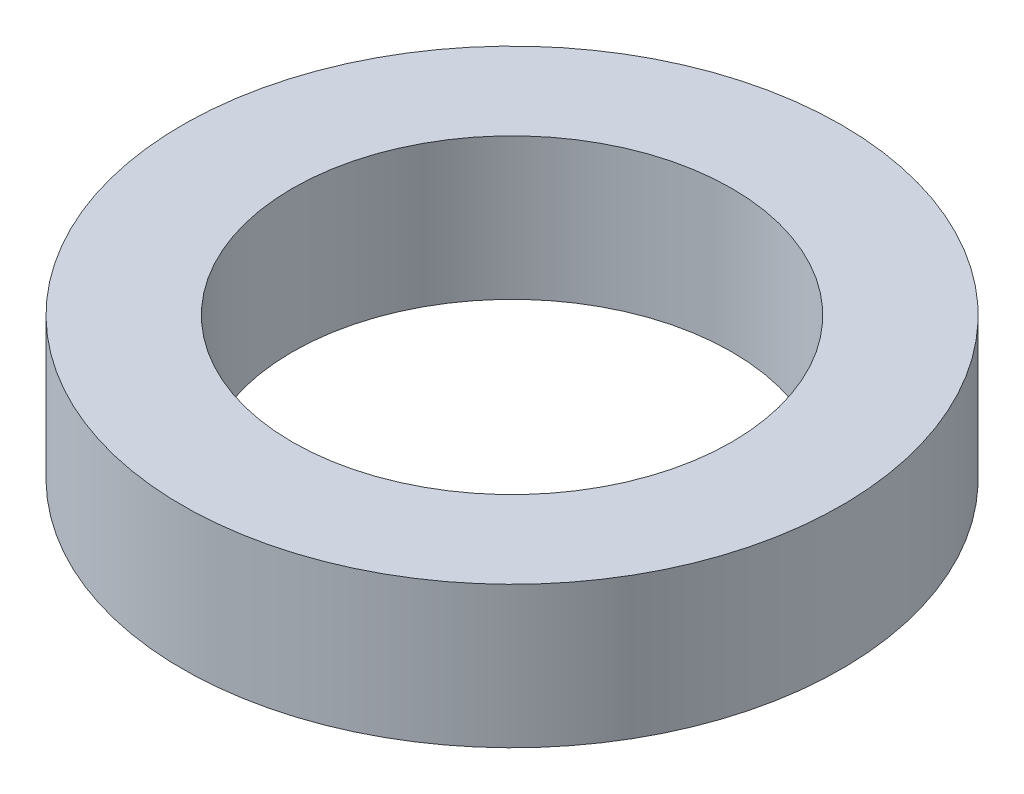
from build123d import *

# Parameters (mm, degrees)
SKETCH1_R           = 67.5
BOSS_EXTRUDE1_DEPTH = 29
SKETCH2_R           = 45
CUT_EXTRUDE1_DEPTH  = 100.767229089


with BuildPart() as part:
    # Sketch1 → Boss-Extrude1 (new body)
    with BuildSketch(Plane(origin=(0, 0, 0), x_dir=(1, 0, 0), z_dir=(0, 1, 0))):
        Circle(SKETCH1_R)
    extrude(amount=BOSS_EXTRUDE1_DEPTH)

    # Sketch2 → Cut-Extrude1 (cut, through all)
    with BuildSketch(Plane(origin=(0, 0, 0), x_dir=(1, 0, 0), z_dir=(0, 1, 0))):
        Circle(SKETCH2_R)
    extrude(amount=CUT_EXTRUDE1_DEPTH, mode=Mode.SUBTRACT)


solid = part.part
